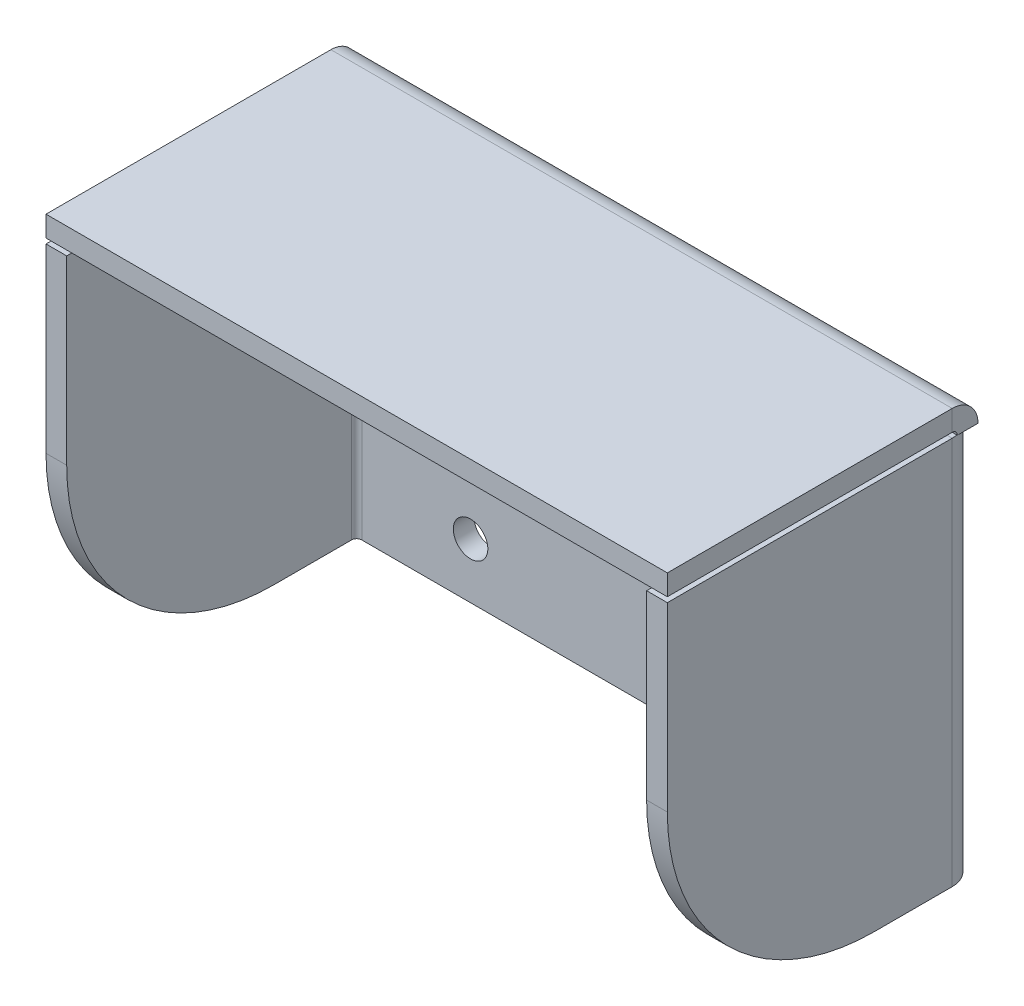
from build123d import *

# Parameters (mm, degrees)
SKETCH_2_W                         = 90
SKETCH_2_H                         = 60
SM_BASE_FLANGE_1_DEPTH             = 3
SM_EDGE_FLANGE_1_STRIP_W           = 13.4732
SM_EDGE_FLANGE_1_STRIP_H           = 3
SM_EDGE_FLANGE_1_STRIP_CUT_DEPTH   = 90
SM_EDGE_FLANGE_1_DEPTH             = 90
SM_EDGE_FLANGE_2_STRIP_W           = 13.4732
SM_EDGE_FLANGE_2_STRIP_H           = 3
SM_EDGE_FLANGE_2_STRIP_CUT_DEPTH   = 56.2634
SM_EDGE_FLANGE_2_STRIP_2_W         = 13.4732
SM_EDGE_FLANGE_2_STRIP_2_H         = 3
SM_EDGE_FLANGE_2_STRIP_CUT_2_DEPTH = 56.2634
SM_EDGE_FLANGE_2_DEPTH             = 56.2634
SM_EDGE_FLANGE_2_BEND_DEPTH        = 56.2634
HOLE_WIZARD_M6_1_D                 = 5
FILLET_1_R                         = 30


# Sheet-metal steps are written as plain solids
with BuildPart() as part:
    # Sketch 2 → 基体-法兰1 (new body)
    with BuildSketch(Plane.XY):
        Rectangle(SKETCH_2_W, SKETCH_2_H)
    extrude(amount=-SM_BASE_FLANGE_1_DEPTH)

    # 边线-法兰1 strip (across the edge) → 边线-法兰1 strip cut (cut)
    with BuildSketch(Plane(origin=(45, 30, 0), x_dir=(0, -1, 0), z_dir=(-1, 0, 0))):
        with Locations((-3, -1.5)):
            Rectangle(SM_EDGE_FLANGE_1_STRIP_W, SM_EDGE_FLANGE_1_STRIP_H)
    extrude(amount=SM_EDGE_FLANGE_1_STRIP_CUT_DEPTH, mode=Mode.SUBTRACT)

    # 边线-法兰1 section (across the edge) → 边线-法兰1 (add)
    with BuildSketch(Plane(origin=(45, 30, 0), x_dir=(0, -1, 0), z_dir=(-1, 0, 0))):
        with BuildLine():
            Line((0, 0.7366), (0, 42))
            Line((0, 42), (3, 42))
            Line((3, 42), (3, 0.7366))
            ThreePointArc((3, 0.7366), (3.215745145, 0.215745145), (3.7366, 0))
            Line((3.7366, 0), (3.7366, -3))
            ThreePointArc((3.7366, -3), (1.094424801, -1.905575199), (0, 0.7366))
        make_face()
    extrude(amount=SM_EDGE_FLANGE_1_DEPTH)

    # 边线-法兰2 strip (across the edge) → 边线-法兰2 strip cut (cut)
    with BuildSketch(Plane(origin=(-45, 26.2634, 0), x_dir=(1, 0, 0), z_dir=(0, -1, 0))):
        with Locations((-3, -1.5)):
            Rectangle(SM_EDGE_FLANGE_2_STRIP_W, SM_EDGE_FLANGE_2_STRIP_H)
    extrude(amount=SM_EDGE_FLANGE_2_STRIP_CUT_DEPTH, mode=Mode.SUBTRACT)

    # 边线-法兰2 strip 2 (across the edge) → 边线-法兰2 strip cut 2 (cut)
    with BuildSketch(Plane(origin=(45, -30, 0), x_dir=(-1, 0, 0), z_dir=(0, 1, 0))):
        with Locations((-3, -1.5)):
            Rectangle(SM_EDGE_FLANGE_2_STRIP_2_W, SM_EDGE_FLANGE_2_STRIP_2_H)
    extrude(amount=SM_EDGE_FLANGE_2_STRIP_CUT_2_DEPTH, mode=Mode.SUBTRACT)

    # 边线-法兰2 section (across the edge) → 边线-法兰2 (add)
    with BuildSketch(Plane(origin=(-45, 26.2634, 0), x_dir=(1, 0, 0), z_dir=(0, -1, 0))):
        with BuildLine():
            Line((0, 0.7366), (0, 42))
            Line((0, 42), (3, 42))
            Line((3, 42), (3, 0.7366))
            ThreePointArc((3, 0.7366), (3.215745145, 0.215745145), (3.7366, 0))
            Line((3.7366, 0), (3.7366, -3))
            ThreePointArc((3.7366, -3), (1.094424801, -1.905575199), (0, 0.7366))
        make_face()
    extrude(amount=SM_EDGE_FLANGE_2_DEPTH)

    # 边线-法兰2 section 2 (across the edge) → 边线-法兰2 bend (add)
    with BuildSketch(Plane(origin=(45, -30, 0), x_dir=(-1, 0, 0), z_dir=(0, 1, 0))):
        with BuildLine():
            Line((0, 0.7366), (0, 42))
            Line((0, 42), (3, 42))
            Line((3, 42), (3, 0.7366))
            ThreePointArc((3, 0.7366), (3.215745145, 0.215745145), (3.7366, 0))
            Line((3.7366, 0), (3.7366, -3))
            ThreePointArc((3.7366, -3), (1.094424801, -1.905575199), (0, 0.7366))
        make_face()
    extrude(amount=SM_EDGE_FLANGE_2_BEND_DEPTH)

    # M6 螺纹孔1 (through all)
    with Locations(Plane(origin=(0, 0, -3), x_dir=(-1, 0, 0), z_dir=(0, 0, -1))):
        with Locations((-25.5, 14), (-25.5, -22), (25.5, -22), (25.5, 14)):
            Hole(HOLE_WIZARD_M6_1_D / 2)

    # 圆角1
    fillet_1_edges = [part.edges().sort_by_distance(p)[0] for p in [
        (43.5, -30, 42),
        (-43.5, -30, 42),
    ]]
    fillet(fillet_1_edges, radius=FILLET_1_R)


solid = part.part
